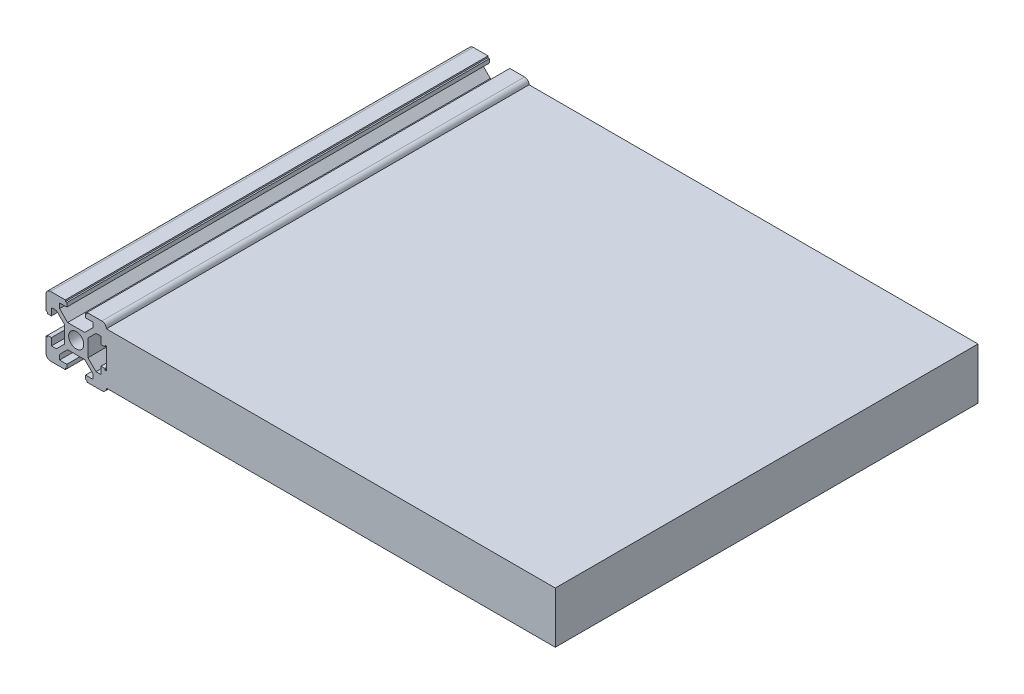
from build123d import *

# Parameters (mm, degrees)
SKETCH1_R           = 2.5
BOSS_EXTRUDE1_DEPTH = 140
SCALE_2_SCALE       = 3
SCALE_3_SCALE       = 6
SCALE_5_SCALE       = 2
SCALE_6_SCALE       = 0.25
SCALE_7_SCALE       = 0.125
SCALE_8_SCALE       = 0.25
SCALE_9_SCALE       = 4
SCALE_10_SCALE      = 4
OTHER_START         = -17.55
OTHER_1_OUTLINE_R   = 5
OTHER_1_DEPTH       = 10
SKETCH_11_W         = 630
SKETCH_11_H         = 76.5
EXTRUDE_1_DEPTH     = 669
SCALE_11_SCALE      = 0.111111111


# Read off the part's stored shape, not the designer's step: 孔1
with BuildPart() as part:
    # Sketch1 → Boss-Extrude1 (new body)
    with BuildSketch(Plane.XY):
        with BuildLine():
            Line((2.839339828, 3.9), (5.5, 6.560660172))
            Line((5.5, 6.560660172), (5.5, 8.2))
            Line((5.5, 8.2), (3.1, 8.2))
            Line((3.1, 8.2), (3.1, 9.5))
            Line((3.1, 9.5), (3.6, 9.5))
            Line((3.6, 9.5), (3.6, 10))
            Line((3.6, 10), (8.5, 10))
            ThreePointArc((8.5, 10), (9.560660172, 9.560660172), (10, 8.5))
            Line((10, 8.5), (10, 3.6))
            Line((10, 3.6), (9.5, 3.6))
            Line((9.5, 3.6), (9.5, 3.1))
            Line((9.5, 3.1), (8.2, 3.1))
            Line((8.2, 3.1), (8.2, 5.5))
            Line((8.2, 5.5), (6.560660172, 5.5))
            Line((6.560660172, 5.5), (3.9, 2.839339828))
            Line((3.9, 2.839339828), (3.9, -2.839339828))
            Line((3.9, -2.839339828), (6.560660172, -5.5))
            Line((6.560660172, -5.5), (8.2, -5.5))
            Line((8.2, -5.5), (8.2, -3.1))
            Line((8.2, -3.1), (9.5, -3.1))
            Line((9.5, -3.1), (9.5, -3.6))
            Line((9.5, -3.6), (10, -3.6))
            Line((10, -3.6), (10, -8.5))
            ThreePointArc((10, -8.5), (9.560660172, -9.560660172), (8.5, -10))
            Line((8.5, -10), (3.6, -10))
            Line((3.6, -10), (3.6, -9.5))
            Line((3.6, -9.5), (3.1, -9.5))
            Line((3.1, -9.5), (3.1, -8.2))
            Line((3.1, -8.2), (5.5, -8.2))
            Line((5.5, -8.2), (5.5, -6.560660172))
            Line((5.5, -6.560660172), (2.839339828, -3.9))
            Line((2.839339828, -3.9), (-2.839339828, -3.9))
            Line((-2.839339828, -3.9), (-5.5, -6.560660172))
            Line((-5.5, -6.560660172), (-5.5, -8.2))
            Line((-5.5, -8.2), (-3.1, -8.2))
            Line((-3.1, -8.2), (-3.1, -9.5))
            Line((-3.1, -9.5), (-3.6, -9.5))
            Line((-3.6, -9.5), (-3.6, -10))
            Line((-3.6, -10), (-8.5, -10))
            ThreePointArc((-8.5, -10), (-9.560660172, -9.560660172), (-10, -8.5))
            Line((-10, -8.5), (-10, -3.6))
            Line((-10, -3.6), (-9.5, -3.6))
            Line((-9.5, -3.6), (-9.5, -3.1))
            Line((-9.5, -3.1), (-8.2, -3.1))
            Line((-8.2, -3.1), (-8.2, -5.5))
            Line((-8.2, -5.5), (-6.560660172, -5.5))
            Line((-6.560660172, -5.5), (-3.9, -2.839339828))
            Line((-3.9, -2.839339828), (-3.9, 2.839339828))
            Line((-3.9, 2.839339828), (-6.560660172, 5.5))
            Line((-6.560660172, 5.5), (-8.2, 5.5))
            Line((-8.2, 5.5), (-8.2, 3.1))
            Line((-8.2, 3.1), (-9.5, 3.1))
            Line((-9.5, 3.1), (-9.5, 3.6))
            Line((-9.5, 3.6), (-10, 3.6))
            Line((-10, 3.6), (-10, 8.5))
            ThreePointArc((-10, 8.5), (-9.560660172, 9.560660172), (-8.5, 10))
            Line((-8.5, 10), (-3.6, 10))
            Line((-3.6, 10), (-3.6, 9.5))
            Line((-3.6, 9.5), (-3.1, 9.5))
            Line((-3.1, 9.5), (-3.1, 8.2))
            Line((-3.1, 8.2), (-5.5, 8.2))
            Line((-5.5, 8.2), (-5.5, 6.560660172))
            Line((-5.5, 6.560660172), (-2.839339828, 3.9))
            Line((-2.839339828, 3.9), (2.839339828, 3.9))
        make_face()
        with Locations((0, 0.235847297)):
            Circle(SKETCH1_R, mode=Mode.SUBTRACT)
    extrude(amount=BOSS_EXTRUDE1_DEPTH)


with BuildPart() as part_1:
    # 缩放比例2: scaled about (0, -0.027095247, 70)
    add(part.part.scale(SCALE_2_SCALE).moved(Location((0, 0.054190494, -140))))


with BuildPart() as part_2:
    # 缩放比例3: scaled about (0, -0.027095247, 70)
    add(part_1.part.scale(SCALE_3_SCALE).moved(Location((0, 0.135476235, -350))))


with BuildPart() as part_3:
    # 缩放比例5: scaled about (0, -0.027095249, 70)
    add(part_2.part.scale(SCALE_5_SCALE).moved(Location((0, 0.027095249, -70))))


with BuildPart() as part_4:
    # 缩放比例6: scaled about (0, -0.027095249, 70)
    add(part_3.part.scale(SCALE_6_SCALE).moved(Location((0, -0.020321437, 52.5))))


with BuildPart() as part_5:
    # 缩放比例7: scaled about (0, -0.027095249, 70)
    add(part_4.part.scale(SCALE_7_SCALE).moved(Location((0, -0.023708343, 61.25))))


with BuildPart() as part_6:
    # 缩放比例8: scaled about (0, -0.027095249, 70)
    add(part_5.part.scale(SCALE_8_SCALE).moved(Location((0, -0.020321437, 52.5))))


with BuildPart() as part_7:
    # 缩放比例9: scaled about (0, -0.027095249, 70)
    add(part_6.part.scale(SCALE_9_SCALE).moved(Location((0, 0.081285747, -210))))


with BuildPart() as part_8:
    # 缩放比例10: scaled about (0, -0.027095249, 70)
    add(part_7.part.scale(SCALE_10_SCALE).moved(Location((0, 0.081285747, -210))))

    # 孔1 outline → 孔1 (cut)
    with BuildSketch(Plane.YZ.offset(OTHER_START)):
        with Locations((7.344833538, 1.297306883)):
            Circle(OTHER_1_OUTLINE_R)
    extrude(amount=OTHER_1_DEPTH, mode=Mode.SUBTRACT)

    # 草图11 → 凸台-拉伸1 (add)
    with BuildSketch(Plane(origin=(45, 0, 0), x_dir=(0, 0, -1), z_dir=(1, 0, 0))):
        with Locations((-70, 0.094833365)):
            Rectangle(SKETCH_11_W, SKETCH_11_H)
    extrude(amount=EXTRUDE_1_DEPTH)


with BuildPart() as part_9:
    # 缩放比例11: scaled about (355.468990582, 0.086965488, 70.001302415)
    add(part_8.part.scale(SCALE_11_SCALE).moved(Location((315.972436073, 0.077302656, 62.223379924))))


solid = part_9.part
